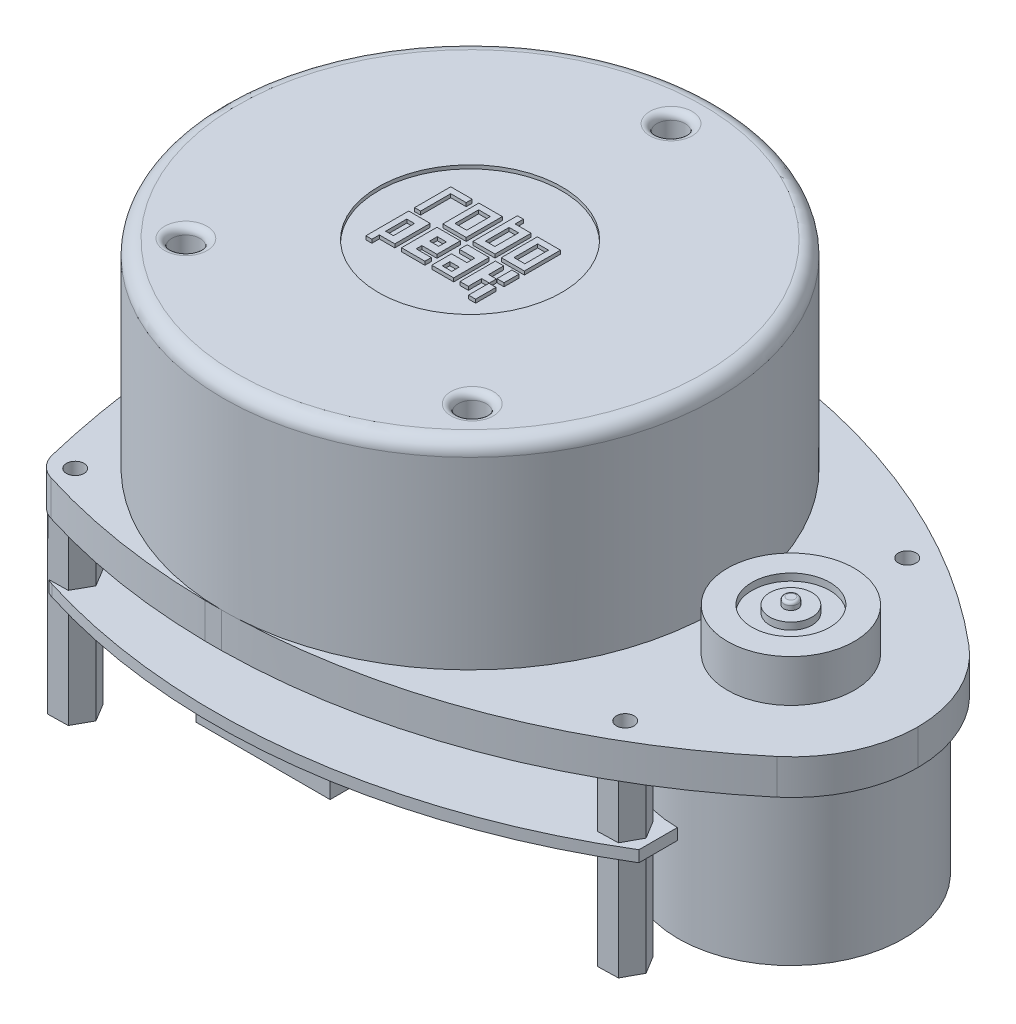
from build123d import *

# Parameters (mm, degrees)
SKETCH_1_W          = 98.5
SKETCH_1_H          = 70
EXTRUDE_1_DEPTH     = 5
SKETCH_2_R          = 35
EXTRUDE_2_DEPTH     = 28.1
SKETCH_3_R          = 2
CUT_EXTRUDE_1_DEPTH = 5
FILLET_1_R          = 2
FILLET_2_R          = 1
SKETCH_4_R          = 13
SKETCH_4_W          = 3.316540618
SKETCH_4_H          = 5.120069114
SKETCH_4_W_2        = 3.276095001
SKETCH_4_W_3        = 1.001370982
SKETCH_4_H_2        = 2.121481923
SKETCH_4_H_3        = 2.893302243
SKETCH_4_W_4        = 1.096399653
SKETCH_4_H_4        = 2.99297568
SKETCH_4_W_5        = 1.536933457
SKETCH_4_H_5        = 3.356986235
SKETCH_4_W_6        = 1.658270309
SKETCH_4_W_7        = 1.334705371
SKETCH_4_H_6        = 1.05158605
SKETCH_4_W_8        = 1.294259754
SKETCH_4_H_7        = 1.092031667
CUT_EXTRUDE_3_DEPTH = 0.5
SKETCH_5_R          = 1.25
CUT_EXTRUDE_4_DEPTH = 5
SKETCH_6_R          = 9
EXTRUDE_3_DEPTH     = 7
CUT_EXTRUDE_START   = -1
SKETCH_7_R          = 9
SKETCH_7_R_2        = 0.99350654
CUT_EXTRUDE_5_DEPTH = 1
SKETCH_8_R          = 5.521677929
SKETCH_8_R_2        = 3.001097475
CUT_EXTRUDE_6_DEPTH = 1
FILLET_3_R          = 0.4
SKETCH_9_R          = 16
EXTRUDE_4_DEPTH     = 27
EXTRUDE_5_DEPTH     = 24.6
SKETCH_11_R         = 26
EXTRUDE_6_DEPTH     = 8
FILLET_4_R          = 1
SKETCH_12_W         = 106.251501727
SKETCH_12_H         = 75.565901032
CUT_EXTRUDE_7_DEPTH = 8
FILLET_5_R          = 100
EXTRUDE_START       = 8
EXTRUDE_7_DEPTH     = 1.6
SKETCH_14_W         = 20
SKETCH_14_H         = 5
EXTRUDE_8_DEPTH     = 6
CHAMFER_1_SIZE      = 1
CUT_EXTRUDE1_START  = -15
SKETCH1_R           = 1.25
CUT_EXTRUDE1_DEPTH  = 15


with BuildPart() as part:
    # Эскиз1 → Бобышка-Вытянуть1 (new body)
    with BuildSketch(Plane(origin=(0, 0, 0), x_dir=(1, 0, 0), z_dir=(0, 1, 0))):
        Rectangle(SKETCH_1_W, SKETCH_1_H)
    extrude(amount=EXTRUDE_1_DEPTH)

    # Эскиз2 → Бобышка-Вытянуть2 (add)
    with BuildSketch(Plane(origin=(0, 5, 0), x_dir=(1, 0, 0), z_dir=(0, 1, 0))):
        with Locations(Location((-14.25, 0, 0), (0, 0, 270))):
            Circle(SKETCH_2_R)
    extrude(amount=EXTRUDE_2_DEPTH)

    # Эскиз3 → Вырез-Вытянуть1 (cut)
    with BuildSketch(Plane(origin=(0, 33.1, 0), x_dir=(1, 0, 0), z_dir=(0, 1, 0))):
        with Locations(Location((-14.25, 28.5, 0), (0, 0, 270))):
            Circle(SKETCH_3_R)
        with Locations(Location((-34.553940504, -20, 0), (0, 0, 270))):
            Circle(SKETCH_3_R)
        with Locations(Location((6.053940504, -20, 0), (0, 0, 270))):
            Circle(SKETCH_3_R)
    extrude(amount=-CUT_EXTRUDE_1_DEPTH, mode=Mode.SUBTRACT)

    # Скругление1
    fillet_1_edges = [part.edges().sort_by_distance(p)[0] for p in [
        (-14.25, 33.1, -35),
    ]]
    fillet(fillet_1_edges, radius=FILLET_1_R)

    # Скругление2
    fillet_2_edges = [part.edges().sort_by_distance(p)[0] for p in [
        (-14.25, 33.1, -30.5),
        (-34.553940504, 33.1, 18),
        (6.053940504, 33.1, 18),
    ]]
    fillet(fillet_2_edges, radius=FILLET_2_R)

    # Эскиз4 → Вырез-Вытянуть3 (cut)
    # profile 1 of 7: a face of its own
    with BuildSketch(Plane(origin=(0, 33.1, 0), x_dir=(1, 0, 0), z_dir=(0, 1, 0))):
        with Locations(Location((-14.25, 0, 0), (0, 0, 270))):
            Circle(SKETCH_4_R)
        Polygon((-22.115166942, -6.914876839), (-22.115166942, -0.831627154), (-19.0735421, -0.831627154), (-19.0735421, -5.853844917), (-21.266341405, -5.853844917), (-21.266341405, -6.914876839), align=None, mode=Mode.SUBTRACT)
        Polygon((-22.115166942, 0), (-22.115166942, 5.120069114), (-19.0735421, 5.120069114), (-19.0735421, 4.27071115), (-21.266341405, 4.27071115), (-21.266341405, 0), align=None, mode=Mode.SUBTRACT)
        Polygon((-13.829606569, 0), (-13.829606569, 6.292992015), (-12.980248606, 6.292992015), (-12.980248606, 5.120069114), (-10.715294037, 5.120069114), (-10.715294037, 0), align=None, mode=Mode.SUBTRACT)
        with Locations((-16.458571693, 2.560034557)):
            Rectangle(SKETCH_4_W, SKETCH_4_H, mode=Mode.SUBTRACT)
        with Locations((-8.187442955, 2.560034557)):
            Rectangle(SKETCH_4_W_2, SKETCH_4_H, mode=Mode.SUBTRACT)
        with Locations((-7.050080946, -1.825090787)):
            Rectangle(SKETCH_4_W_3, SKETCH_4_H_2, mode=Mode.SUBTRACT)
        with Locations((-7.050080946, -5.468225718)):
            Rectangle(SKETCH_4_W_3, SKETCH_4_H_3, mode=Mode.SUBTRACT)
        Polygon((-9.825490456, -0.831627154), (-8.643651064, -0.831627154), (-8.643651064, -2.960833634), (-7.550766437, -2.960833634), (-7.550766437, -3.957287265), (-8.643651064, -3.957287265), (-8.643651064, -5.853844917), (-9.825490456, -5.853844917), align=None, mode=Mode.SUBTRACT)
        Polygon((-13.829606569, -0.831627154), (-10.715294037, -0.831627154), (-10.715294037, -5.853844917), (-13.829606569, -5.853844917), (-13.829606569, -3.04994558), (-11.645543235, -3.04994558), (-11.645543235, -1.940786367), (-13.829606569, -1.940786367), align=None, mode=Mode.SUBTRACT)
        Polygon((-18.116842002, -0.831627154), (-14.800301384, -0.831627154), (-14.800301384, -4.141977247), (-16.943919101, -4.141977247), (-16.943919101, -4.950889593), (-14.800301384, -4.950889593), (-14.800301384, -5.853844917), (-18.116842002, -5.853844917), align=None, mode=Mode.SUBTRACT)
    # profile 2 of 7: a face of its own
    with BuildSketch(Plane(origin=(0, 33.1, 0), x_dir=(1, 0, 0), z_dir=(0, 1, 0))):
        with Locations((-20.718141579, -3.454401753)):
            Rectangle(SKETCH_4_W_4, SKETCH_4_H_4)
    # profile 3 of 7: a face of its own
    with BuildSketch(Plane(origin=(0, 33.1, 0), x_dir=(1, 0, 0), z_dir=(0, 1, 0))):
        with Locations((-8.167220148, 2.592218033)):
            Rectangle(SKETCH_4_W_5, SKETCH_4_H_5)
    # profile 4 of 7: a face of its own
    with BuildSketch(Plane(origin=(0, 33.1, 0), x_dir=(1, 0, 0), z_dir=(0, 1, 0))):
        with Locations((-16.478794502, 2.592218033)):
            Rectangle(SKETCH_4_W_6, SKETCH_4_H_5)
    # profile 5 of 7: a face of its own
    with BuildSketch(Plane(origin=(0, 33.1, 0), x_dir=(1, 0, 0), z_dir=(0, 1, 0))):
        with Locations((-12.312895921, 2.592218033)):
            Rectangle(SKETCH_4_W_7, SKETCH_4_H_5)
    # profile 6 of 7: a face of its own
    with BuildSketch(Plane(origin=(0, 33.1, 0), x_dir=(1, 0, 0), z_dir=(0, 1, 0))):
        with Locations((-12.312895921, -4.667770272)):
            Rectangle(SKETCH_4_W_7, SKETCH_4_H_6)
    # profile 7 of 7: a face of its own
    with BuildSketch(Plane(origin=(0, 33.1, 0), x_dir=(1, 0, 0), z_dir=(0, 1, 0))):
        with Locations((-16.296789224, -2.503929746)):
            Rectangle(SKETCH_4_W_8, SKETCH_4_H_7)
    extrude(amount=-CUT_EXTRUDE_3_DEPTH, mode=Mode.SUBTRACT)

    # Эскиз5 → Вырез-Вытянуть4 (cut)
    with BuildSketch(Plane(origin=(0, 5, 0), x_dir=(1, 0, 0), z_dir=(0, 1, 0))):
        with Locations(Location((-42.25, 28, 0), (0, 0, 270))):
            Circle(SKETCH_5_R)
        with Locations(Location((27.75, 20, 0), (0, 0, 270))):
            Circle(SKETCH_5_R)
        with Locations(Location((27.75, -20, 0), (0, 0, 90))):
            Circle(SKETCH_5_R)
        with Locations(Location((-42.25, -28, 0), (0, 0, 90))):
            Circle(SKETCH_5_R)
    extrude(amount=-CUT_EXTRUDE_4_DEPTH, mode=Mode.SUBTRACT)

    # Эскиз6 → Бобышка-Вытянуть3 (add)
    with BuildSketch(Plane(origin=(0, 5, 0), x_dir=(1, 0, 0), z_dir=(0, 1, 0))):
        with Locations(Location((31.25, 0, 0), (0, 0, 270))):
            Circle(SKETCH_6_R)
    extrude(amount=EXTRUDE_3_DEPTH)

    # Эскиз7 → Вырез-Вытянуть5 (cut)
    with BuildSketch(Plane(origin=(0, 12, 0), x_dir=(1, 0, 0), z_dir=(0, 1, 0)).offset(CUT_EXTRUDE_START)):
        with Locations(Location((31.25, 0, 0), (0, 0, 270))):
            Circle(SKETCH_7_R)
        with Locations(Location((31.25, 0, 0), (0, 0, 270))):
            Circle(SKETCH_7_R_2, mode=Mode.SUBTRACT)
    extrude(amount=CUT_EXTRUDE_5_DEPTH, mode=Mode.SUBTRACT)

    # Эскиз8 → Вырез-Вытянуть6 (cut)
    with BuildSketch(Plane(origin=(0, 11, 0), x_dir=(1, 0, 0), z_dir=(0, 1, 0))):
        with Locations(Location((31.25, 0, 0), (0, 0, 270))):
            Circle(SKETCH_8_R)
        with Locations(Location((31.25, 0, 0), (0, 0, 270))):
            Circle(SKETCH_8_R_2, mode=Mode.SUBTRACT)
    extrude(amount=-CUT_EXTRUDE_6_DEPTH, mode=Mode.SUBTRACT)

    # Скругление3
    fillet_3_edges = [part.edges().sort_by_distance(p)[0] for p in [
        (31.25, 12, -0.99350654),
    ]]
    fillet(fillet_3_edges, radius=FILLET_3_R)

    # Эскиз9 → Бобышка-Вытянуть4 (add)
    with BuildSketch(Plane(origin=(0, 5, 0), x_dir=(1, 0, 0), z_dir=(0, 1, 0))):
        with Locations(Location((31.25, 0, 0), (0, 0, 270))):
            Circle(SKETCH_9_R)
    extrude(amount=-EXTRUDE_4_DEPTH)

    # Эскиз10 → Бобышка-Вытянуть5 (add)
    with BuildSketch(Plane.XZ):
        Polygon((-40.854614908, 25.472900125), (-39.363774764, 27.944889), (-40.759159856, 30.471988875), (-43.645385092, 30.527099875), (-45.136225236, 28.055111), (-43.740840144, 25.528011125), align=None)
        Polygon((29.257133708, 22.462088812), (26.371335397, 22.536260484), (24.864201688, 20.074171672), (26.242866292, 17.537911188), (29.128664603, 17.463739516), (30.635798312, 19.925828328), align=None)
        Polygon((30.635798312, -19.925828328), (29.257133708, -22.462088812), (26.371335397, -22.536260484), (24.864201688, -20.074171672), (26.242866292, -17.537911188), (29.128664603, -17.463739516), align=None)
        Polygon((-43.740840144, -25.528011125), (-40.854614908, -25.472900125), (-39.363774764, -27.944889), (-40.759159856, -30.471988875), (-43.645385092, -30.527099875), (-45.136225236, -28.055111), align=None)
    extrude(amount=EXTRUDE_5_DEPTH)

    # Эскиз11 → Бобышка-Вытянуть6 (add)
    with BuildSketch(Plane(origin=(0, 5, 0), x_dir=(1, 0, 0), z_dir=(0, 1, 0))):
        with Locations(Location((-14.25, 0, 0), (0, 0, 270))):
            Circle(SKETCH_11_R)
    extrude(amount=-EXTRUDE_6_DEPTH)

    # Скругление4
    fillet_4_edges = [part.edges().sort_by_distance(p)[0] for p in [
        (-14.25, -3, -26),
    ]]
    fillet(fillet_4_edges, radius=FILLET_4_R)

    # Эскиз12 → Вырез-Вытянуть7 (cut)
    with BuildSketch(Plane(origin=(0, 5, 0), x_dir=(1, 0, 0), z_dir=(0, 1, 0))):
        with Locations((-0.925367694, -0.052186396)):
            Rectangle(SKETCH_12_W, SKETCH_12_H)
        with BuildLine():
            ThreePointArc((-49.25, 0), (-48.116981176, 14.083966884), (-45.528607092, 27.974329531))
            ThreePointArc((-45.528607092, 27.974329531), (-44.561596332, 29.769996926), (-42.834972324, 30.855492545))
            ThreePointArc((-42.834972324, 30.855492545), (2.249574036, 33.221442581), (42.908955543, 13.599293477))
            ThreePointArc((42.908955543, 13.599293477), (47.577997957, 7.498372972), (49.25, 0))
            ThreePointArc((49.25, 0), (47.577997957, -7.498372972), (42.908955543, -13.599293477))
            ThreePointArc((42.908955543, -13.599293477), (2.249574036, -33.221442581), (-42.834972324, -30.855492545))
            ThreePointArc((-42.834972324, -30.855492545), (-44.561596332, -29.769996926), (-45.528607092, -27.974329531))
            ThreePointArc((-45.528607092, -27.974329531), (-48.116981176, -14.083966884), (-49.25, 0))
        make_face(mode=Mode.SUBTRACT)
    extrude(amount=-CUT_EXTRUDE_7_DEPTH, mode=Mode.SUBTRACT)

    # Скругление5
    # the kernel refuses this fillet: 100 mm, written as the material it takes off along each edge
    with BuildSketch(Plane(origin=(-49.25, 5, 0), x_dir=(0.06766370453174418, 0, 0.9977081853372963), z_dir=(0, -1, 0))) as fillet_5_piece_1:
        with BuildLine():
            CenterArc((6.776645039, -99.922318338), FILLET_5_R, 87.741474483, 12.276669201)
            ThreePointArc((-10.619357471, -1.44704684), (-5.323940761, -0.618859533), (0, 0))
            ThreePointArc((0, 0), (5.358747467, 0.105631125), (10.717494933, 0))
        make_face()
    extrude(amount=31.793737334, mode=Mode.SUBTRACT)

    # Эскиз13 → Бобышка-Вытянуть7 (add)
    with BuildSketch(Plane.XZ.offset(EXTRUDE_START)):
        with BuildLine():
            Line((31.553634402, 21.860321538), (31.553634402, 16.4))
            ThreePointArc((31.553634402, 16.4), (15.153634402, 0), (31.553634402, -16.4))
            Line((31.553634402, -16.4), (31.553634402, -21.860321538))
            ThreePointArc((31.553634402, -21.860321538), (-4.596615235, -34.347840749), (-42.683124513, -30.855492545))
            ThreePointArc((-42.683124513, -30.855492545), (-44.409748521, -29.769996926), (-45.37675928, -27.974329531))
            ThreePointArc((-45.37675928, -27.974329531), (-47.965133365, -14.083966884), (-49.098152188, 0))
            ThreePointArc((-49.098152188, 0), (-47.965133365, 14.083966884), (-45.37675928, 27.974329531))
            ThreePointArc((-45.37675928, 27.974329531), (-44.409748521, 29.769996926), (-42.683124513, 30.855492545))
            ThreePointArc((-42.683124513, 30.855492545), (-4.596615235, 34.347840749), (31.553634402, 21.860321538))
        make_face()
    extrude(amount=EXTRUDE_7_DEPTH)

    # Эскиз14 → Бобышка-Вытянуть8 (add)
    with BuildSketch(Plane.XZ.offset(9.6)):
        with Locations((-14.098152188, 27.5)):
            Rectangle(SKETCH_14_W, SKETCH_14_H)
    extrude(amount=EXTRUDE_8_DEPTH)

    # Фаска1
    chamfer_1_edges = [part.edges().sort_by_distance(p)[0] for p in [
        (-24.098152188, -12.6, 30),
    ]]
    chamfer(chamfer_1_edges, length=CHAMFER_1_SIZE)

    # Sketch1 → Cut-Extrude1 (cut)
    with BuildSketch(Plane.XZ.offset(24.6).offset(CUT_EXTRUDE1_START)):
        with Locations(Location((27.75, 20, 0), (0, 0, 270))):
            Circle(SKETCH1_R)
        with Locations(Location((27.75, -20, 0), (0, 0, 90))):
            Circle(SKETCH1_R)
        with Locations(Location((-42.201393787, -27.999071889, 0), (0, 0, 270))):
            Circle(SKETCH1_R)
        with Locations(Location((-42.25, 28, 0), (0, 0, 270))):
            Circle(SKETCH1_R)
    extrude(amount=CUT_EXTRUDE1_DEPTH, mode=Mode.SUBTRACT)


solid = part.part
